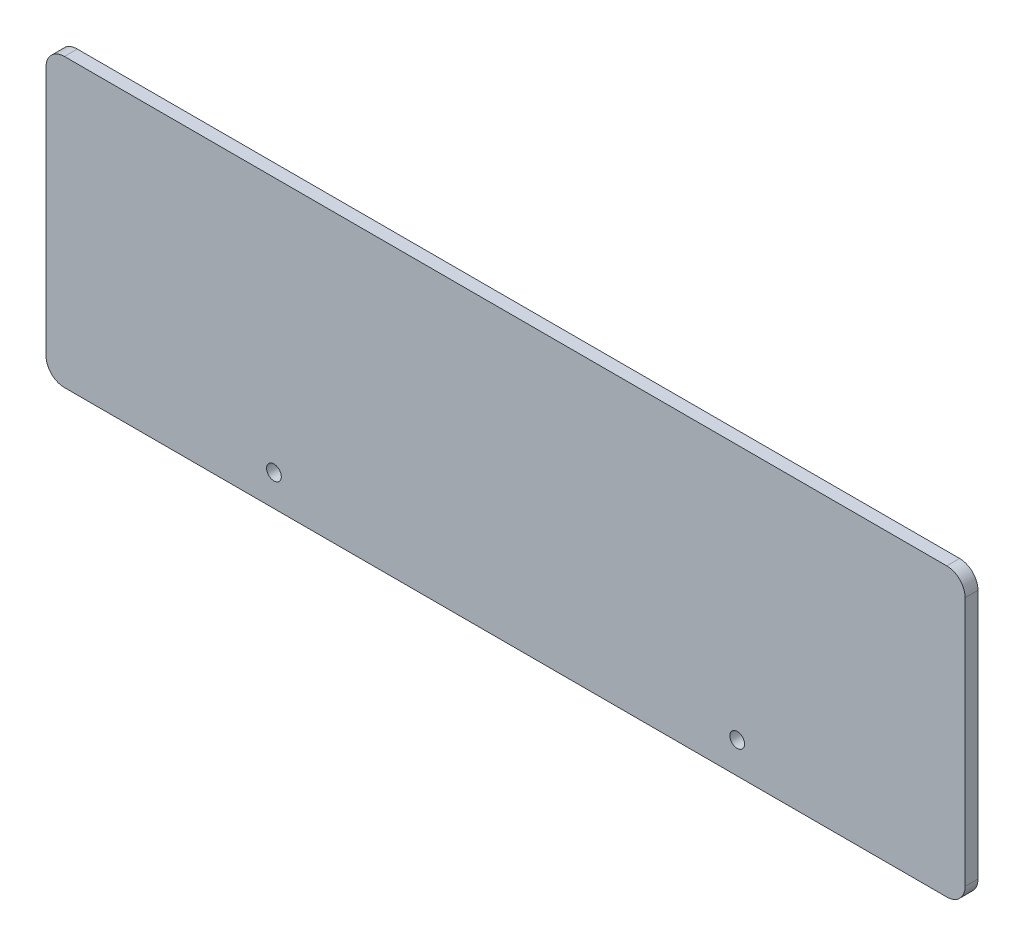
from build123d import *

# Parameters (mm, degrees)
BOSS_EXTRU_1_DEPTH      = 3.5
ESQUISSE2_R             = 2
ENL_V_MAT_EXTRU_1_DEPTH = 262.908858193


with BuildPart() as part:
    # Esquisse1 → Boss.-Extru.1 (new body)
    with BuildSketch(Plane.XY):
        with BuildLine():
            Line((5, 0), (245, 0))
            ThreePointArc((245, 0), (248.535533906, 1.464466094), (250, 5))
            Line((250, 5), (250, 73))
            ThreePointArc((250, 73), (248.535533906, 76.535533906), (245, 78))
            Line((245, 78), (5, 78))
            ThreePointArc((5, 78), (1.464466094, 76.535533906), (0, 73))
            Line((0, 73), (0, 5))
            ThreePointArc((0, 5), (1.464466094, 1.464466094), (5, 0))
        make_face()
    extrude(amount=BOSS_EXTRU_1_DEPTH)

    # Esquisse2 → Enlèv. mat.-Extru.1 (cut, through all)
    with BuildSketch(Plane.XY.offset(3.5)):
        with Locations((62, 8.5)):
            Circle(ESQUISSE2_R)
        with Locations((188, 8.5)):
            Circle(ESQUISSE2_R)
    extrude(amount=-ENL_V_MAT_EXTRU_1_DEPTH, mode=Mode.SUBTRACT)


solid = part.part
